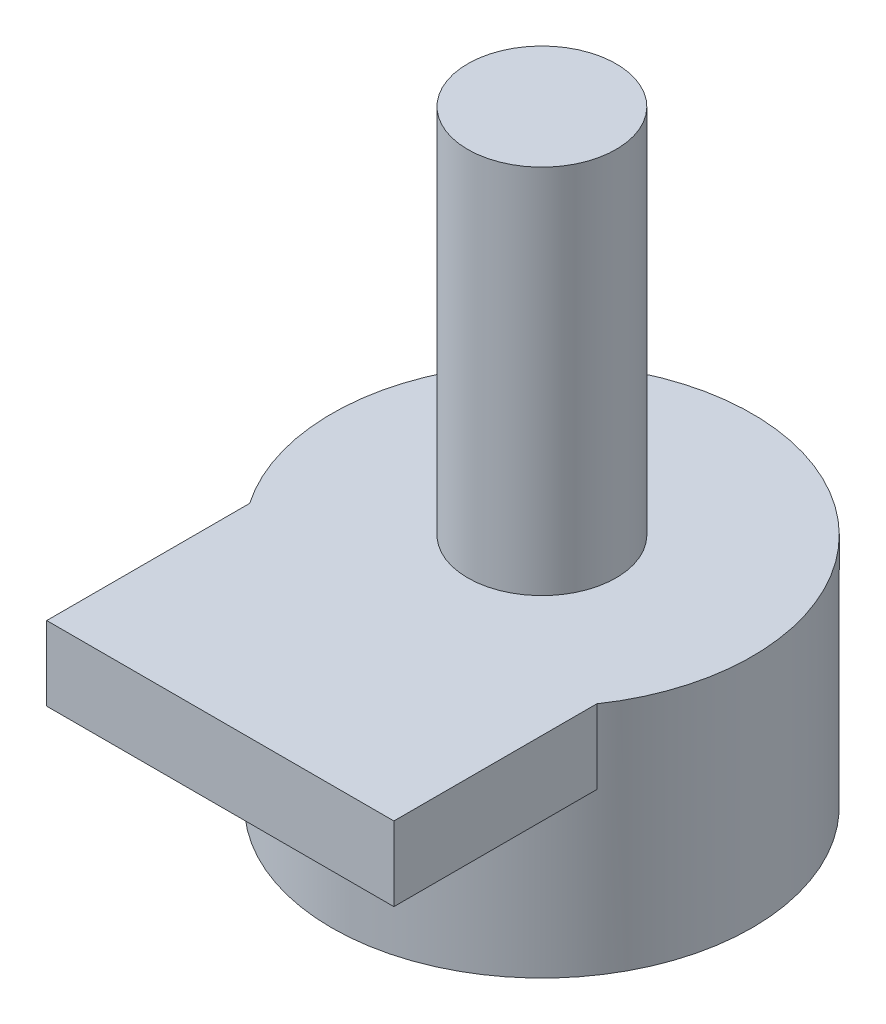
from build123d import *
from build123d.topology import SkipClean

# Parameters (mm, degrees)
SKETCH1_R           = 8.5
BOSS_EXTRUDE1_DEPTH = 9.5
SKETCH2_R           = 3
BOSS_EXTRUDE2_DEPTH = 15
SKETCH3_W           = 16.912520663
SKETCH3_H           = 13
BOSS_EXTRUDE3_DEPTH = 3
CUT_EXTRUDE2_DEPTH  = 24.774986856


with BuildPart() as part:
    # Sketch1 → Boss-Extrude1 (new body)
    with BuildSketch(Plane(origin=(0, 0, 0), x_dir=(1, 0, 0), z_dir=(0, 1, 0))):
        Circle(SKETCH1_R)
    extrude(amount=BOSS_EXTRUDE1_DEPTH)

    # Sketch2 → Boss-Extrude2 (add)
    with BuildSketch(Plane(origin=(0, 9.5, 0), x_dir=(1, 0, 0), z_dir=(0, 1, 0))):
        Circle(SKETCH2_R)
    extrude(amount=BOSS_EXTRUDE2_DEPTH)

    # Sketch3 → Boss-Extrude3 (add)
    with BuildSketch(Plane(origin=(0, 9.5, 0), x_dir=(1, 0, 0), z_dir=(0, 1, 0))):
        with Locations((0.043739668, -6.5)):
            Rectangle(SKETCH3_W, SKETCH3_H)
    extrude(amount=-BOSS_EXTRUDE3_DEPTH)

    # Sketch4 → Cut-Extrude2 (cut, through all)
    with SkipClean():  # the faces are left unmerged after this step: merging them gives an invalid solid
        with BuildSketch(Plane.XZ.offset(-6.5)):
            with BuildLine():
                Line((-7.016472339, 13), (-7.016472339, 4.797824081))
                ThreePointArc((-7.016472339, 4.797824081), (-7.919608809, 3.087036818), (-8.412520663, 1.216345382))
                Line((-8.412520663, 1.216345382), (-8.412520663, 13))
                Line((-8.412520663, 13), (-7.016472339, 13))
            make_face()
            with BuildLine():
                Line((7.016472339, 13), (7.016472339, 4.797824081))
                ThreePointArc((7.016472339, 4.797824081), (8.120653141, 2.510974424), (8.5, 0))
                Line((8.5, 0), (8.5, 13))
                Line((8.5, 13), (7.016472339, 13))
            make_face()
        extrude(amount=-CUT_EXTRUDE2_DEPTH, mode=Mode.SUBTRACT)


solid = part.part
